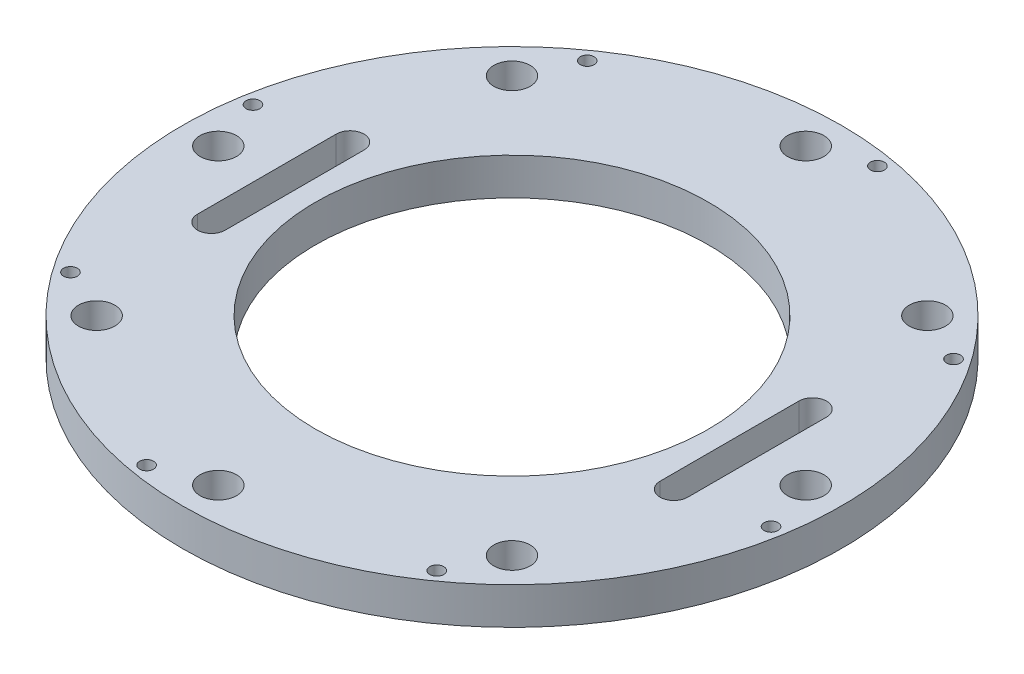
from build123d import *

# Parameters (mm, degrees)
SKETCH1_R           = 14.25
SKETCH1_R_2         = 0.3
SKETCH1_R_3         = 0.7874
SKETCH1_R_4         = 8.5
BOSS_EXTRUDE1_DEPTH = 1.6


with BuildPart() as part:
    # Sketch1 → Boss-Extrude1 (new body)
    with BuildSketch(Plane(origin=(0, 0, 0), x_dir=(1, 0, 0), z_dir=(0, 1, 0))):
        Circle(SKETCH1_R)
        with Locations((-11.172287143, -7.919595949)):
            Circle(SKETCH1_R_2, mode=Mode.SUBTRACT)
        with Locations((-8.980256121, -8.980256121)):
            Circle(SKETCH1_R_3, mode=Mode.SUBTRACT)
        with Locations((-2.3, -13.5)):
            Circle(SKETCH1_R_2, mode=Mode.SUBTRACT)
        with Locations((0, -12.7)):
            Circle(SKETCH1_R_3, mode=Mode.SUBTRACT)
        with Locations((7.919595949, -11.172287143)):
            Circle(SKETCH1_R_2, mode=Mode.SUBTRACT)
        with Locations((8.980256121, -8.980256121)):
            Circle(SKETCH1_R_3, mode=Mode.SUBTRACT)
        with Locations((13.5, -2.3)):
            Circle(SKETCH1_R_2, mode=Mode.SUBTRACT)
        with Locations((12.7, 0)):
            Circle(SKETCH1_R_3, mode=Mode.SUBTRACT)
        with Locations((-12.7, 0)):
            Circle(SKETCH1_R_3, mode=Mode.SUBTRACT)
        with Locations((-13.5, 2.3)):
            Circle(SKETCH1_R_2, mode=Mode.SUBTRACT)
        with BuildLine():
            Line((-9.4, 3), (-9.4, -3))
            ThreePointArc((-9.4, -3), (-10, -3.6), (-10.6, -3))
            Line((-10.6, -3), (-10.6, 3))
            ThreePointArc((-10.6, 3), (-10, 3.6), (-9.4, 3))
        make_face(mode=Mode.SUBTRACT)
        with Locations((-8.980256121, 8.980256121)):
            Circle(SKETCH1_R_3, mode=Mode.SUBTRACT)
        with Locations((-7.919595949, 11.172287143)):
            Circle(SKETCH1_R_2, mode=Mode.SUBTRACT)
        Circle(SKETCH1_R_4, mode=Mode.SUBTRACT)
        with BuildLine():
            ThreePointArc((10.6, -3), (10, -3.6), (9.4, -3))
            Line((9.4, -3), (9.4, 3))
            ThreePointArc((9.4, 3), (10, 3.6), (10.6, 3))
            Line((10.6, 3), (10.6, -3))
        make_face(mode=Mode.SUBTRACT)
        with Locations((0, 12.7)):
            Circle(SKETCH1_R_3, mode=Mode.SUBTRACT)
        with Locations((2.3, 13.5)):
            Circle(SKETCH1_R_2, mode=Mode.SUBTRACT)
        with Locations((8.980256121, 8.980256121)):
            Circle(SKETCH1_R_3, mode=Mode.SUBTRACT)
        with Locations((11.172287143, 7.919595949)):
            Circle(SKETCH1_R_2, mode=Mode.SUBTRACT)
    extrude(amount=BOSS_EXTRUDE1_DEPTH)


solid = part.part
